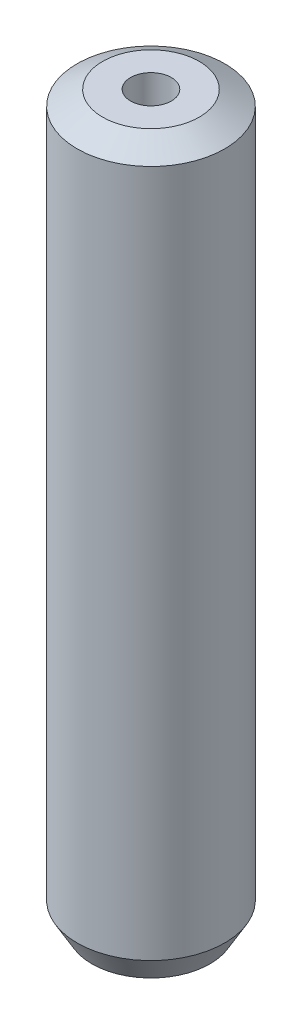
from build123d import *
from OCP.BRepFilletAPI import BRepFilletAPI_MakeChamfer

# Parameters (mm, degrees)
SKETCH1_R           = 7.5
BOSS_EXTRUDE1_DEPTH = 73.969211294
SKETCH2_R           = 2.07305361
CUT_EXTRUDE1_DEPTH  = 75.725793535
CHAMFER1_SIZE       = 1.495285484
CHAMFER1_SIZE2      = 2.58991043


with BuildPart() as part:
    # Sketch1 → Boss-Extrude1 (new body)
    with BuildSketch(Plane(origin=(0, 0, 0), x_dir=(1, 0, 0), z_dir=(0, 1, 0))):
        Circle(SKETCH1_R)
    extrude(amount=BOSS_EXTRUDE1_DEPTH)

    # Sketch2 → Cut-Extrude1 (cut, through all)
    with BuildSketch(Plane(origin=(0, 0, 0), x_dir=(1, 0, 0), z_dir=(0, 1, 0))):
        Circle(SKETCH2_R)
    extrude(amount=CUT_EXTRUDE1_DEPTH, mode=Mode.SUBTRACT)

    # Chamfer1: one chamfer whose edges measure the first distance from different faces: ONE call of the kernel's chamfer builder (chamfer() names one face for all edges)
    chamfer1_edges_1 = [part.edges().sort_by_distance(p)[0] for p in [
        (-7.5, 73.969211294, 0),
    ]]
    chamfer1_side_1 = [part.faces().sort_by_distance(p)[0] for p in [
        (-7.5, 36.984605647, 0),
    ]]
    chamfer1_edges_2 = [part.edges().sort_by_distance(p)[0] for p in [
        (-7.5, 0, 0),
    ]]
    chamfer1_side_2 = [part.faces().sort_by_distance(p)[0] for p in [
        (-7.287867966, 0, 0),
    ]]
    chamfer1 = BRepFilletAPI_MakeChamfer(part.part.solid().wrapped)
    for e in chamfer1_edges_1:
        chamfer1.Add(CHAMFER1_SIZE, CHAMFER1_SIZE2, e.wrapped, chamfer1_side_1[0].wrapped)  # the first distance lies on this face
    for e in chamfer1_edges_2:
        chamfer1.Add(CHAMFER1_SIZE, CHAMFER1_SIZE2, e.wrapped, chamfer1_side_2[0].wrapped)  # the first distance lies on this face
    add(Compound.cast(chamfer1.Shape()), mode=Mode.REPLACE)


solid = part.part
